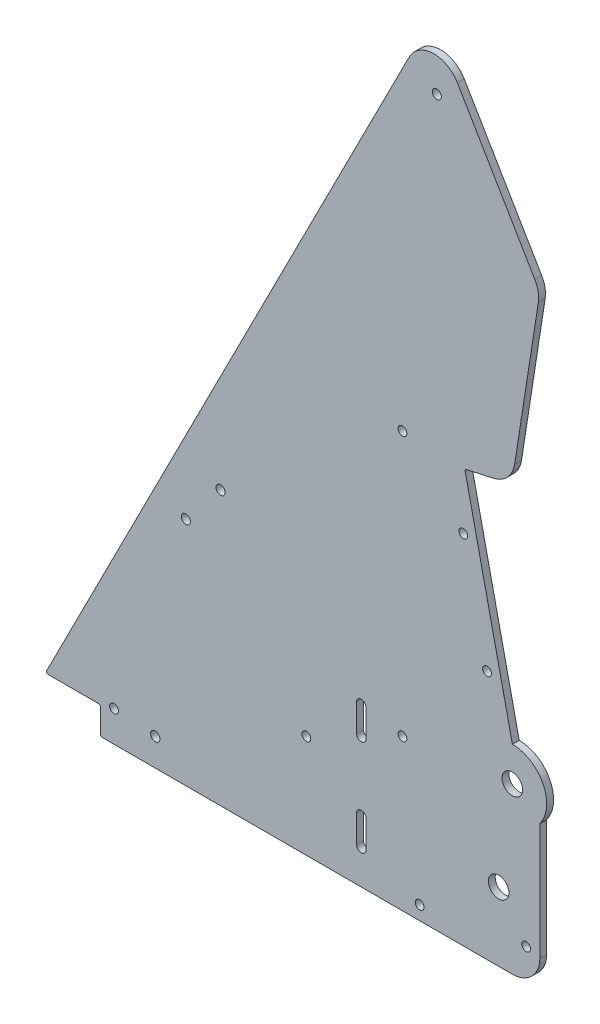
from build123d import *

# Parameters (mm, degrees)
BOSS_EXTRUDE1_DEPTH = 3.175
SKETCH2_R           = 2.0955
SKETCH2_R_2         = 2.032
SKETCH2_R_3         = 4.7625
CUT_EXTRUDE1_DEPTH  = 421.976111717
SKETCH7_R           = 2.159
CUT_EXTRUDE2_DEPTH  = 421.976111717
CUT_EXTRUDE3_REACH  = 422.976
SKETCH10_R          = 2.032
FILLET1_R           = 12.7
FILLET2_R           = 0.79375
SKETCH12_R          = 2.032
CUT_EXTRUDE5_DEPTH  = 410.593447353


with BuildPart() as part:
    # Sketch1 → Boss-Extrude1 (new body)
    with BuildSketch(Plane.XY):
        with BuildLine():
            Line((228.6, -12.7), (228.6, 53.975))
            ThreePointArc((228.6, 53.975), (230.099031657, 70.599515829), (215.9, 79.375))
            Line((215.9, 79.375), (193.909735224, 178.566674323))
            Line((193.909735224, 178.566674323), (215.607913982, 183.377044743))
            Line((215.607913982, 183.377044743), (228.6, 266.7))
            Line((228.6, 266.7), (178.754725958, 351.413083686))
            Line((178.754725958, 351.413083686), (0, 0))
            Line((0, 0), (25.4, 0))
            Line((25.4, 0), (25.4, -12.7))
            Line((25.4, -12.7), (228.6, -12.7))
        make_face()
    extrude(amount=BOSS_EXTRUDE1_DEPTH)

    # Sketch2 → Cut-Extrude1 (cut, through all)
    with BuildSketch(Plane.XY.offset(3.175)):
        with Locations((64.943150167, 94.057839899)):
            Circle(SKETCH2_R)
        with Locations((180.975, 322.164313376)):
            Circle(SKETCH2_R)
        with Locations((81.00705334, 113.73297687)):
            Circle(SKETCH2_R)
        with Locations((193.207821773, 152.394364194)):
            Circle(SKETCH2_R_2)
        with Locations((215.9, 63.5)):
            Circle(SKETCH2_R_3)
        with Locations((173.0375, -6.35)):
            Circle(SKETCH2_R_2)
        with Locations((204.202954161, 102.798527032)):
            Circle(SKETCH2_R_2)
        with Locations((209.55, 19.05)):
            Circle(SKETCH2_R_3)
        with Locations((165.1, 179.3875)):
            Circle(SKETCH2_R_2)
    extrude(amount=-CUT_EXTRUDE1_DEPTH, mode=Mode.SUBTRACT)

    # Sketch7 → Cut-Extrude2 (cut, through all)
    with BuildSketch(Plane.XY.offset(3.175)):
        with Locations((50.8, 0)):
            Circle(SKETCH7_R)
        with BuildLine():
            Line((143.891, 3.175), (143.891, 15.875))
            ThreePointArc((143.891, 15.875), (146.05, 18.034), (148.209, 15.875))
            Line((148.209, 15.875), (148.209, 3.175))
            ThreePointArc((148.209, 3.175), (146.05, 1.016), (143.891, 3.175))
        make_face()
        with BuildLine():
            Line((143.891, 47.625), (143.891, 60.325))
            ThreePointArc((143.891, 60.325), (146.05, 62.484), (148.209, 60.325))
            Line((148.209, 60.325), (148.209, 47.625))
            ThreePointArc((148.209, 47.625), (146.05, 45.466), (143.891, 47.625))
        make_face()
    extrude(amount=-CUT_EXTRUDE2_DEPTH, mode=Mode.SUBTRACT)

    # Sketch10 → Cut-Extrude3 (cut, up to next)
    with BuildSketch(Plane.XY.offset(3.175), mode=Mode.PRIVATE) as cut_extrude3_sk1:
        with Locations((165.1, 57.15)):
            Circle(SKETCH10_R)
    cut_extrude3_tool1 = extrude(cut_extrude3_sk1.sketch, amount=-CUT_EXTRUDE3_REACH, mode=Mode.PRIVATE) & part.part
    # Sketch10 → Cut-Extrude3 (cut, up to next)
    with BuildSketch(Plane.XY.offset(3.175), mode=Mode.PRIVATE) as cut_extrude3_sk2:
        with Locations((120.65, 34.925)):
            Circle(SKETCH10_R)
    cut_extrude3_tool2 = extrude(cut_extrude3_sk2.sketch, amount=-CUT_EXTRUDE3_REACH, mode=Mode.PRIVATE) & part.part
    add(cut_extrude3_tool1.solids().sort_by_distance((165.1, 57.15, 3.175))[0], mode=Mode.SUBTRACT)
    add(cut_extrude3_tool2.solids().sort_by_distance((120.65, 34.925, 3.175))[0], mode=Mode.SUBTRACT)

    # Fillet1
    fillet1_edges = [part.edges().sort_by_distance(p)[0] for p in [
        (228.6, -12.7, 1.5875),
        (178.754725958, 351.413083686, 1.5875),
        (215.607913982, 183.377044743, 1.5875),
        (228.6, 266.7, 1.5875),
    ]]
    fillet(fillet1_edges, radius=FILLET1_R)

    # Fillet2
    fillet2_edges = [part.edges().sort_by_distance(p)[0] for p in [
        (25.4, -12.7, 1.5875),
        (25.4, 0, 1.5875),
        (193.909735224, 178.566674323, 1.5875),
        (0, 0, 1.5875),
    ]]
    fillet(fillet2_edges, radius=FILLET2_R)

    # Sketch12 → Cut-Extrude5 (cut, through all)
    with BuildSketch(Plane.XY.offset(3.175)):
        with Locations((31.75, 1.5875)):
            Circle(SKETCH12_R)
        with Locations((222.25, 1.5875)):
            Circle(SKETCH12_R)
    extrude(amount=-CUT_EXTRUDE5_DEPTH, mode=Mode.SUBTRACT)


solid = part.part
